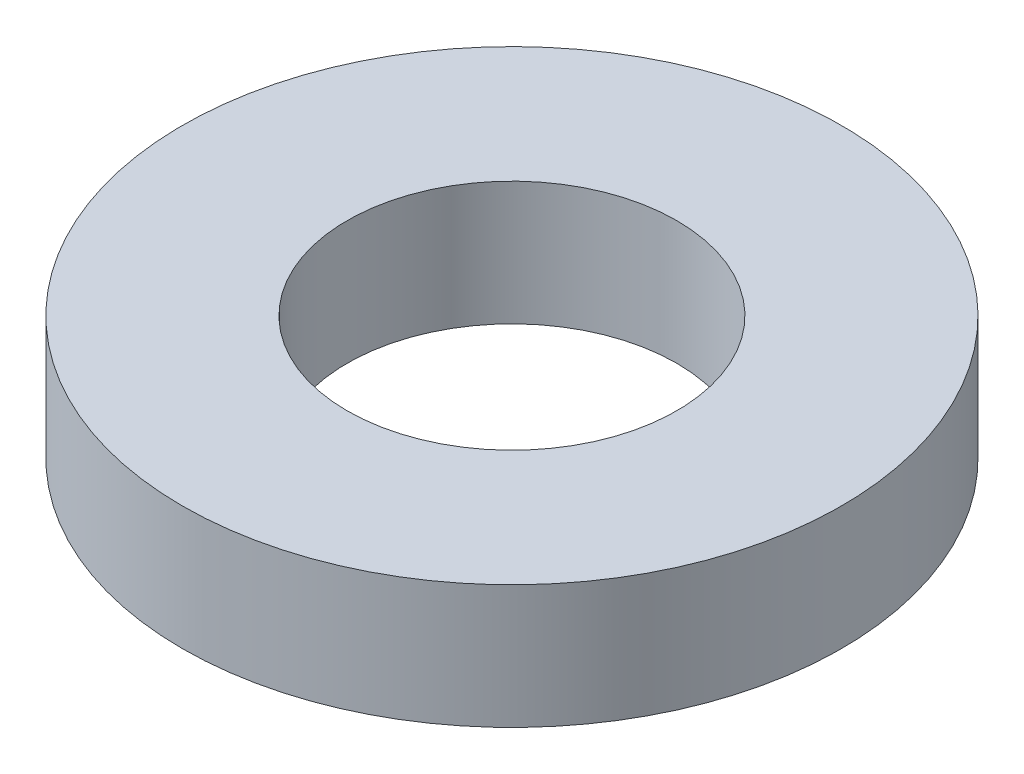
from build123d import *

# Parameters (mm, degrees)
SKETCH1_R           = 40
BOSS_EXTRUDE1_DEPTH = 15
SKETCH2_R           = 20
CUT_EXTRUDE1_DEPTH  = 59.523499554


with BuildPart() as part:
    # Sketch1 → Boss-Extrude1 (new body)
    with BuildSketch(Plane(origin=(0, 0, 0), x_dir=(1, 0, 0), z_dir=(0, 1, 0))):
        Circle(SKETCH1_R)
    extrude(amount=BOSS_EXTRUDE1_DEPTH)

    # Sketch2 → Cut-Extrude1 (cut, through all)
    with BuildSketch(Plane(origin=(0, 0, 0), x_dir=(1, 0, 0), z_dir=(0, 1, 0))):
        Circle(SKETCH2_R)
    extrude(amount=CUT_EXTRUDE1_DEPTH, mode=Mode.SUBTRACT)


solid = part.part
